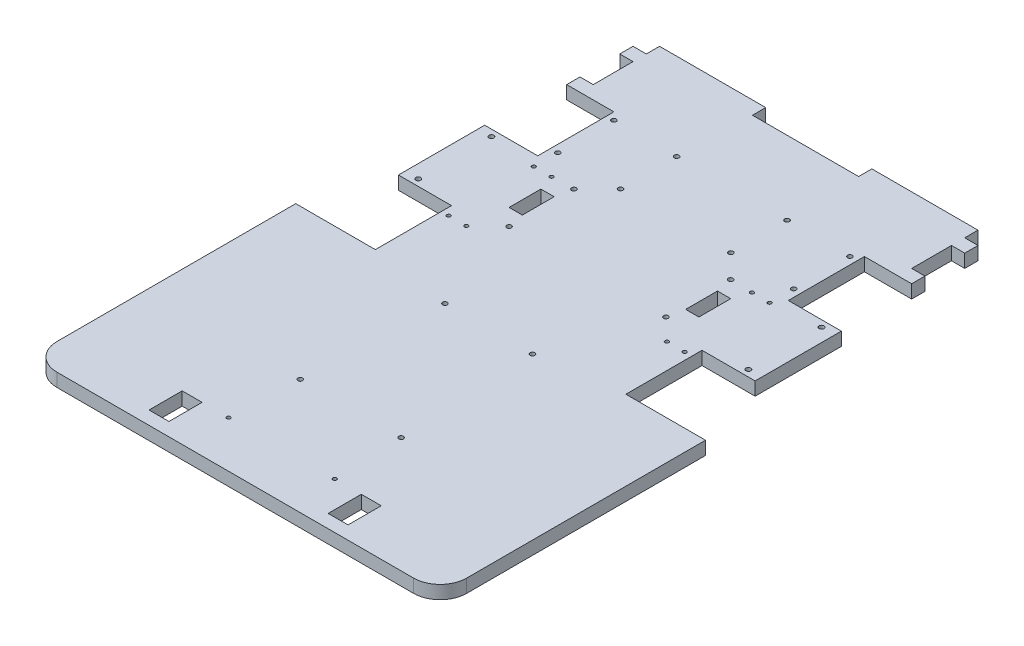
from build123d import *

# Parameters (mm, degrees)
SKETCH1_R           = 0.889
SKETCH1_R_2         = 1.1303
SKETCH1_W           = 6.35
SKETCH1_H           = 15.24
SKETCH1_W_2         = 9.525
SKETCH1_H_2         = 15.875
BOSS_EXTRUDE1_DEPTH = 6.35
SKETCH2_R           = 1.1684
CUT_EXTRUDE1_DEPTH  = 6.35


with BuildPart() as part:
    # Sketch1 → Boss-Extrude1 (new body)
    with BuildSketch(Plane(origin=(0, 0, 0), x_dir=(1, 0, 0), z_dir=(0, 1, 0))):
        with BuildLine():
            Line((-147.642205972, 18.314662121), (-147.642205972, -22.960337879))
            Line((-147.642205972, -22.960337879), (-122.242205972, -22.960337879))
            Line((-122.242205972, -22.960337879), (-122.242205972, -59.409337879))
            Line((-122.242205972, -59.409337879), (-147.642205972, -59.409337879))
            Line((-147.642205972, -59.409337879), (-160.342205972, -59.409337879))
            Line((-160.342205972, -59.409337879), (-160.342205972, -72.109337879))
            Line((-160.342205972, -72.109337879), (-160.342205972, -173.709337879))
            ThreePointArc((-160.342205972, -173.709337879), (-156.622462093, -182.689594), (-147.642205972, -186.409337879))
            Line((-147.642205972, -186.409337879), (-62.292205972, -186.409337879))
            Line((-62.292205972, -186.409337879), (-62.292205972, 86.513662121))
            Line((-62.292205972, 86.513662121), (-87.692205972, 86.513662121))
            Line((-87.692205972, 86.513662121), (-87.692205972, 92.863662121))
            Line((-87.692205972, 92.863662121), (-138.492205972, 92.863662121))
            Line((-138.492205972, 92.863662121), (-138.492205972, 86.513662121))
            Line((-138.492205972, 86.513662121), (-144.842205972, 86.513662121))
            Line((-144.842205972, 86.513662121), (-144.842205972, 80.163662121))
            Line((-144.842205972, 80.163662121), (-138.492205972, 80.163662121))
            Line((-138.492205972, 80.163662121), (-138.492205972, 61.113662121))
            Line((-138.492205972, 61.113662121), (-144.842205972, 61.113662121))
            Line((-144.842205972, 61.113662121), (-144.842205972, 54.763662121))
            Line((-144.842205972, 54.763662121), (-122.242205972, 54.763662121))
            Line((-122.242205972, 54.763662121), (-122.242205972, 18.314662121))
            Line((-122.242205972, 18.314662121), (-147.642205972, 18.314662121))
        make_face()
        with Locations((-118.749705972, -27.815337973)):
            Circle(SKETCH1_R, mode=Mode.SUBTRACT)
        with Locations((-118.749705972, 12.919662091)):
            Circle(SKETCH1_R, mode=Mode.SUBTRACT)
        with Locations((-110.264705924, 12.919662091)):
            Circle(SKETCH1_R, mode=Mode.SUBTRACT)
        with Locations((-110.264705924, -27.815337973)):
            Circle(SKETCH1_R, mode=Mode.SUBTRACT)
        with Locations((-118.749705972, 51.271162121)):
            Circle(SKETCH1_R_2, mode=Mode.SUBTRACT)
        with Locations((-118.749705972, 24.397962121)):
            Circle(SKETCH1_R_2, mode=Mode.SUBTRACT)
        with Locations((-88.701505972, 51.271162121)):
            Circle(SKETCH1_R_2, mode=Mode.SUBTRACT)
        with Locations((-88.701505972, 24.397962121)):
            Circle(SKETCH1_R_2, mode=Mode.SUBTRACT)
        with Locations((-99.792205972, 13.177162121)):
            Circle(SKETCH1_R_2, mode=Mode.SUBTRACT)
        with Locations((-99.792205972, -17.822837879)):
            Circle(SKETCH1_R_2, mode=Mode.SUBTRACT)
        with Locations((-83.247205972, -65.124337879)):
            Circle(SKETCH1_R_2, mode=Mode.SUBTRACT)
        with Locations((-86.422205972, -131.164337879)):
            Circle(SKETCH1_R_2, mode=Mode.SUBTRACT)
        with Locations((-87.692205972, -164.184337879)):
            Circle(SKETCH1_R, mode=Mode.SUBTRACT)
        with Locations((-104.549705924, -2.322837879)):
            Rectangle(SKETCH1_W, SKETCH1_H, mode=Mode.SUBTRACT)
        with Locations((-105.154705972, -172.121837879)):
            Rectangle(SKETCH1_W_2, SKETCH1_H_2, mode=Mode.SUBTRACT)
    boss_extrude1 = extrude(amount=BOSS_EXTRUDE1_DEPTH)

    # Sketch2 → Cut-Extrude1 (cut)
    with BuildSketch(Plane(origin=(0, 6.35, 0), x_dir=(1, 0, 0), z_dir=(0, 1, 0))):
        with Locations((-141.292205972, 15.177162121)):
            Circle(SKETCH2_R)
        with Locations((-141.292205972, -19.822837879)):
            Circle(SKETCH2_R)
    cut_extrude1 = extrude(amount=-CUT_EXTRUDE1_DEPTH, mode=Mode.SUBTRACT)

    # Mirror1: Boss-Extrude1, Cut-Extrude1 across plane
    add(boss_extrude1.mirror(Plane(origin=(-62.292205972, 6.35, -86.513662121), x_dir=(0, 0, 1), z_dir=(-1, 0, 0))))
    add(cut_extrude1.mirror(Plane(origin=(-62.292205972, 6.35, -86.513662121), x_dir=(0, 0, 1), z_dir=(-1, 0, 0))), mode=Mode.SUBTRACT)


solid = part.part
